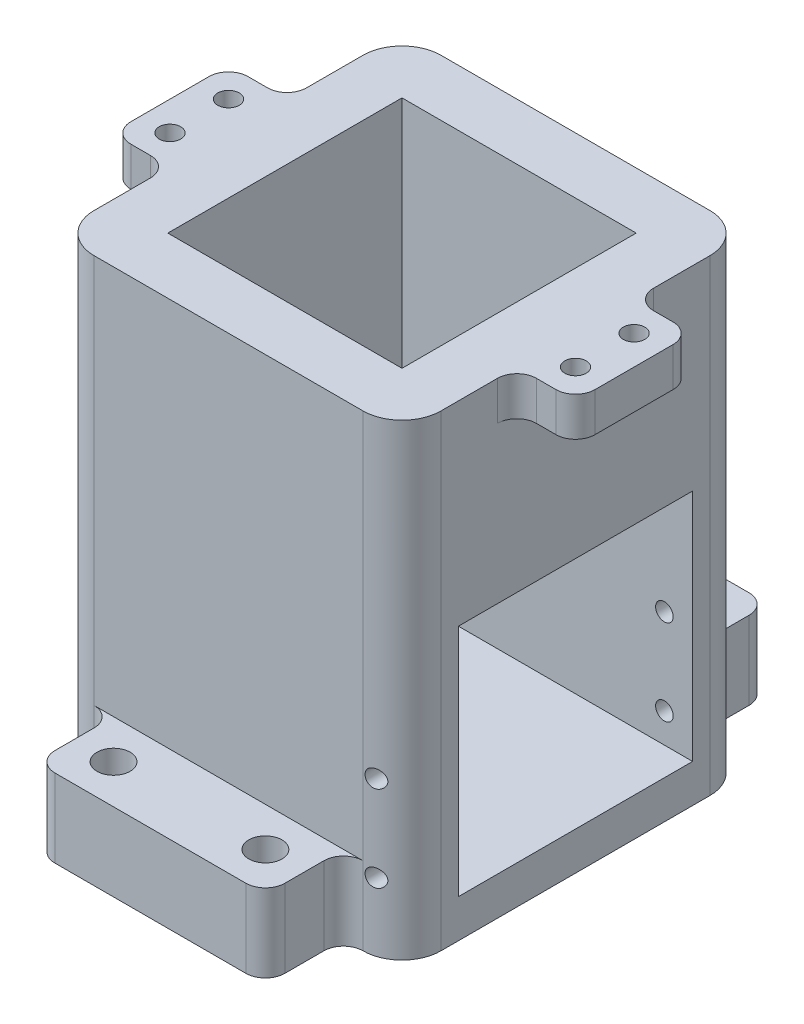
from build123d import *

# Parameters (mm, degrees)
SKETCH3_W            = 88.9
SKETCH3_H            = 88.9
BOSS_EXTRUDE2_DEPTH  = 50.8
SKETCH13_R           = 4.25
CUT_EXTRUDE4_DEPTH   = 102
SKETCH30_W           = 88.9
SKETCH30_H           = 88.9
SKETCH30_W_2         = 60
SKETCH30_H_2         = 60
BOSS_EXTRUDE8_DEPTH  = 110
SKETCH31_W           = 15
SKETCH31_H           = 15
SKETCH31_R           = 2.75
BOSS_EXTRUDE10_DEPTH = 10
FILLET1_R            = 10
SKETCH33_W           = 60
SKETCH33_H           = 60
CUT_EXTRUDE5_DEPTH   = 20
SKETCH37_R           = 2.25
CUT_EXTRUDE6_DEPTH   = 113
SKETCH38_W           = 88.9
SKETCH38_H           = 88.9
CUT_EXTRUDE7_DEPTH   = 41
SKETCH39_W           = 29.45
SKETCH39_H           = 20
BOSS_EXTRUDE11_DEPTH = 20
SKETCH40_W           = 29.45
SKETCH40_H           = 20
BOSS_EXTRUDE12_DEPTH = 20
SKETCH41_R           = 4.25
CUT_EXTRUDE8_DEPTH   = 20
FILLET2_R            = 5
FILLET3_R            = 5


with BuildPart() as part:
    # Sketch3 → Boss-Extrude2 (new body)
    with BuildSketch(Plane(origin=(0, 0, 0), x_dir=(1, 0, 0), z_dir=(0, 1, 0))):
        with Locations((44.45, 44.45)):
            Rectangle(SKETCH3_W, SKETCH3_H)
    extrude(amount=BOSS_EXTRUDE2_DEPTH)

    # Sketch13 → Cut-Extrude4 (cut)
    with BuildSketch(Plane.XY):
        with Locations((44.45, 20)):
            Circle(SKETCH13_R)
    extrude(amount=-CUT_EXTRUDE4_DEPTH, mode=Mode.SUBTRACT)

    # Sketch30 → Boss-Extrude8 (add)
    with BuildSketch(Plane(origin=(0, 50.8, 0), x_dir=(1, 0, 0), z_dir=(0, 1, 0))):
        with Locations((44.45, 44.45)):
            Rectangle(SKETCH30_W, SKETCH30_H)
        with Locations((44.45, 44.45)):
            Rectangle(SKETCH30_W_2, SKETCH30_H_2, mode=Mode.SUBTRACT)
    extrude(amount=BOSS_EXTRUDE8_DEPTH)

    # Sketch31 → Boss-Extrude10 (add)
    # profile 1 of 4: a face of its own
    with BuildSketch(Plane(origin=(0, 160.8, 0), x_dir=(1, 0, 0), z_dir=(0, 1, 0))):
        with Locations((-7.5, 51.95)):
            Rectangle(SKETCH31_W, SKETCH31_H)
        with Locations(Location((-7.5, 51.95, 0), (0, 0, 270))):
            Circle(SKETCH31_R, mode=Mode.SUBTRACT)
    # profile 2 of 4: a face of its own
    with BuildSketch(Plane(origin=(0, 160.8, 0), x_dir=(1, 0, 0), z_dir=(0, 1, 0))):
        with Locations((-7.5, 36.95)):
            Rectangle(SKETCH31_W, SKETCH31_H)
        with Locations(Location((-7.5, 36.95, 0), (0, 0, 270))):
            Circle(SKETCH31_R, mode=Mode.SUBTRACT)
    # profile 3 of 4: a face of its own
    with BuildSketch(Plane(origin=(0, 160.8, 0), x_dir=(1, 0, 0), z_dir=(0, 1, 0))):
        with Locations((96.4, 51.95)):
            Rectangle(SKETCH31_W, SKETCH31_H)
        with Locations(Location((96.4, 51.95, 0), (0, 0, 270))):
            Circle(SKETCH31_R, mode=Mode.SUBTRACT)
    # profile 4 of 4: a face of its own
    with BuildSketch(Plane(origin=(0, 160.8, 0), x_dir=(1, 0, 0), z_dir=(0, 1, 0))):
        with Locations((96.4, 36.95)):
            Rectangle(SKETCH31_W, SKETCH31_H)
        with Locations(Location((96.4, 36.95, 0), (0, 0, 270))):
            Circle(SKETCH31_R, mode=Mode.SUBTRACT)
    extrude(amount=-BOSS_EXTRUDE10_DEPTH)

    # Fillet1
    fillet1_edges = [part.edges().sort_by_distance(p)[0] for p in [
        (0, 80.4, -88.9),
        (88.9, 80.4, -88.9),
        (88.9, 80.4, 0),
        (0, 80.4, 0),
    ]]
    fillet(fillet1_edges, radius=FILLET1_R)

    # Sketch33 → Cut-Extrude5 (cut)
    with BuildSketch(Plane(origin=(88.9, 0, 0), x_dir=(0, 0, -1), z_dir=(1, 0, 0))):
        with Locations((44.45, 80.8)):
            Rectangle(SKETCH33_W, SKETCH33_H)
    extrude(amount=-CUT_EXTRUDE5_DEPTH, mode=Mode.SUBTRACT)

    # Sketch37 → Cut-Extrude6 (cut)
    with BuildSketch(Plane.XY):
        with Locations((81.675, 80.4)):
            Circle(SKETCH37_R)
        with Locations((81.675, 58.4)):
            Circle(SKETCH37_R)
    extrude(amount=-CUT_EXTRUDE6_DEPTH, mode=Mode.SUBTRACT)

    # Sketch38 → Cut-Extrude7 (cut)
    with BuildSketch(Plane.XZ):
        with Locations((44.45, -44.45)):
            Rectangle(SKETCH38_W, SKETCH38_H)
    extrude(amount=-CUT_EXTRUDE7_DEPTH, mode=Mode.SUBTRACT)

    # Sketch39 → Boss-Extrude11 (add)
    with BuildSketch(Plane.XY):
        with Locations((29.725, 51)):
            Rectangle(SKETCH39_W, SKETCH39_H)
        with Locations((59.175, 51)):
            Rectangle(SKETCH39_W, SKETCH39_H)
    extrude(amount=BOSS_EXTRUDE11_DEPTH)

    # Sketch40 → Boss-Extrude12 (add)
    with BuildSketch(Plane(origin=(0, 0, -88.9), x_dir=(-1, 0, 0), z_dir=(0, 0, -1))):
        with Locations((-59.175, 51)):
            Rectangle(SKETCH40_W, SKETCH40_H)
        with Locations((-29.725, 51)):
            Rectangle(SKETCH40_W, SKETCH40_H)
    extrude(amount=BOSS_EXTRUDE12_DEPTH)

    # Sketch41 → Cut-Extrude8 (cut)
    with BuildSketch(Plane.XZ.offset(-41)):
        with Locations(Location((63.9, 10, 0), (0, 0, 270))):
            Circle(SKETCH41_R)
        with Locations(Location((25, 10, 0), (0, 0, 270))):
            Circle(SKETCH41_R)
        with Locations(Location((63.9, -98.9, 0), (0, 0, 270))):
            Circle(SKETCH41_R)
        with Locations(Location((25, -98.9, 0), (0, 0, 270))):
            Circle(SKETCH41_R)
    extrude(amount=-CUT_EXTRUDE8_DEPTH, mode=Mode.SUBTRACT)

    # Fillet2
    fillet2_edges = [part.edges().sort_by_distance(p)[0] for p in [
        (15, 51, -108.9),
        (15, 51, -88.9),
        (73.9, 51, -108.9),
        (73.9, 51, -88.9),
        (73.9, 51, 0),
        (15, 51, 0),
        (15, 51, 20),
        (73.9, 51, 20),
    ]]
    fillet(fillet2_edges, radius=FILLET2_R - 0.0001)  # a hair under: the kernel refuses the full size

    # Fillet3
    fillet3_edges = [part.edges().sort_by_distance(p)[0] for p in [
        (-15, 155.8, -29.45),
        (-15, 155.8, -59.45),
        (0, 155.8, -59.45),
        (0, 155.8, -29.45),
        (88.9, 155.8, -29.45),
        (88.9, 155.8, -59.45),
        (103.9, 155.8, -59.45),
        (103.9, 155.8, -29.45),
    ]]
    fillet(fillet3_edges, radius=FILLET3_R)


solid = part.part
